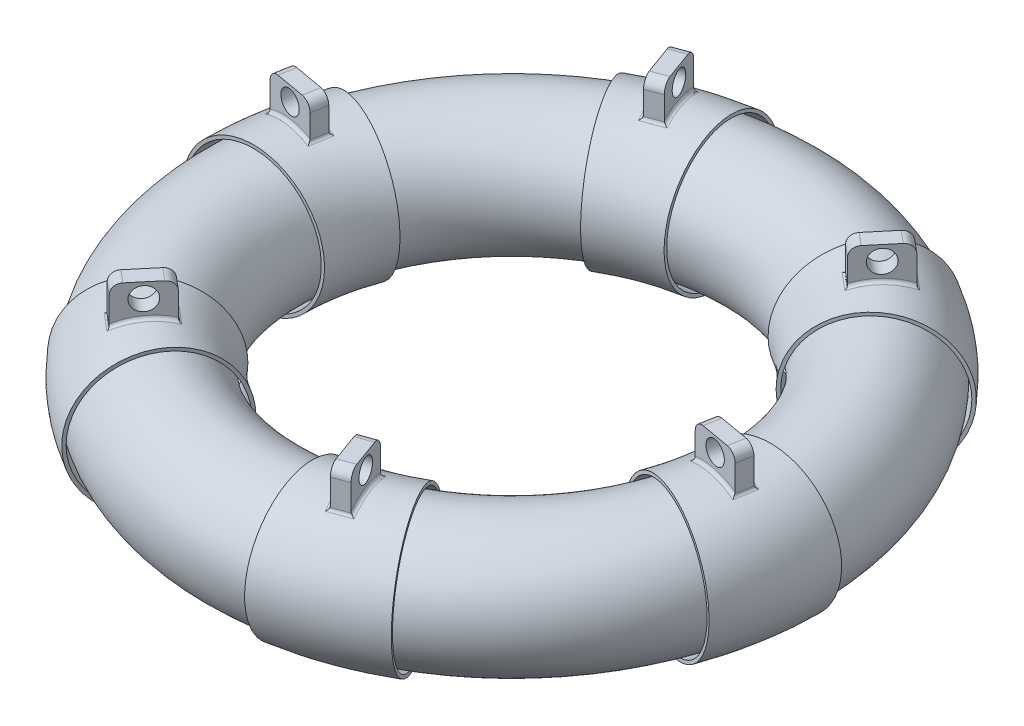
from build123d import *

# Parameters (mm, degrees)
SKETCH1_R                                  = 20
SKETCH2_R                                  = 22
SKETCH2_R_2                                = 21
REVOLVE_THIN1_ANGLE                        = 20
BOSS_EXTRUDE1_START                        = 22
BOSS_EXTRUDE1_DEPTH                        = 10
BOSS_EXTRUDE1_DIRECTION_2_REACH            = 168.527
BOSS_EXTRUDE1_DIRECTION_2_END_MAJOR_RADIUS = 80
BOSS_EXTRUDE1_DIRECTION_2_END_MINOR_RADIUS = 22
FILLET3_R                                  = 1
FILLET4_R                                  = 3
SKETCH5_R                                  = 3.5
CUT_EXTRUDE2_DEPTH                         = 10
CIRPATTERN3_COUNT                          = 6


with BuildPart() as part:
    # Sketch1 → Revolve1 (revolve)
    with BuildSketch(Plane.XY, mode=Mode.PRIVATE) as revolve1_sk:
        with Locations((-80, 0)):
            Circle(SKETCH1_R)
    revolve(revolve1_sk.sketch.rotate(Axis((0, 14.215537248, 0), (0, -1, 0)), 270), axis=Axis((0, 14.215537248, 0), (0, -1, 0)))


with BuildPart() as body_2:
    # Sketch2 → Revolve-Thin1 (revolve)
    with BuildSketch(Plane.XY):
        with Locations((-80, 0)):
            Circle(SKETCH2_R)
        with Locations((-80, 0)):
            Circle(SKETCH2_R_2, mode=Mode.SUBTRACT)
    revolve(axis=Axis((0, 0, 0), (0, -1, 0)), revolution_arc=REVOLVE_THIN1_ANGLE)

    # Sketch3 → Boss-Extrude1 (add)
    with BuildSketch(Plane(origin=(0, 0, 0), x_dir=(1, 0, 0), z_dir=(0, 1, 0)).offset(BOSS_EXTRUDE1_START)):
        Polygon((-86.914637332, 17.86396211), (-71.914637332, 15.219057399), (-72.78287822, 10.295018634), (-87.78287822, 12.939923345), align=None)
    extrude(amount=BOSS_EXTRUDE1_DEPTH)

    # Boss-Extrude1 direction 2: up to this torus (the profile starts outside it)
    boss_extrude1_direction_2_end = Plane(origin=(0, 0, 0), z_dir=(0, 1, 0)) * Torus(BOSS_EXTRUDE1_DIRECTION_2_END_MAJOR_RADIUS, BOSS_EXTRUDE1_DIRECTION_2_END_MINOR_RADIUS, mode=Mode.PRIVATE)
    # Sketch3 → Boss-Extrude1 direction 2 (add, up to the surface)
    with BuildSketch(Plane(origin=(0, 0, 0), x_dir=(1, 0, 0), z_dir=(0, 1, 0)).offset(BOSS_EXTRUDE1_START), mode=Mode.PRIVATE) as boss_extrude1_direction_2_sk1:
        Polygon((-86.914637332, 17.86396211), (-71.914637332, 15.219057399), (-72.78287822, 10.295018634), (-87.78287822, 12.939923345), align=None)
    boss_extrude1_direction_2_tool1 = extrude(boss_extrude1_direction_2_sk1.sketch, amount=-BOSS_EXTRUDE1_DIRECTION_2_REACH, mode=Mode.PRIVATE) - boss_extrude1_direction_2_end
    add(boss_extrude1_direction_2_tool1.solids().sort_by_distance((-79.848758, 22, -14.07949))[0])
    add(boss_extrude1_direction_2_tool1.solids().sort_by_distance((-79.848758, 22, -14.07949))[1])

    # Fillet3
    fillet3_edges = [body_2.edges().sort_by_distance(p)[0] for p in [
        (-79.487427081, 21.967631588, -16.554344551),
        (-72.348757776, 21.006948071, -12.757038017),
        (-80.35566797, 21.967631588, -11.630305786),
        (-87.348757776, 20.208294852, -15.401942727),
    ]]
    fillet(fillet3_edges, radius=FILLET3_R)

    # Fillet4
    fillet4_edges = [body_2.edges().sort_by_distance(p)[0] for p in [
        (-87.348757776, 32, -15.401942727),
        (-72.348757776, 32, -12.757038017),
    ]]
    fillet(fillet4_edges, radius=FILLET4_R)

    # Sketch5 → Cut-Extrude2 (cut)
    with BuildSketch(Plane(origin=(-0.434120444, 0, 2.462019383), x_dir=(0.9848077530122079, 0, 0.17364817766693155), z_dir=(-0.17364817766693155, 0, 0.9848077530122079))):
        with Locations((-81.080553572, 27.485463455)):
            Circle(SKETCH5_R)
    extrude(amount=-CUT_EXTRUDE2_DEPTH, mode=Mode.SUBTRACT)


with BuildPart() as cirpattern3_1:
    # CirPattern3: pattern copy
    add(body_2.part.rotate(Axis((0, 0, 0), (0, 1, 0)), 1 * 360 / CIRPATTERN3_COUNT))


with BuildPart() as cirpattern3_2:
    # CirPattern3: pattern copy
    add(body_2.part.rotate(Axis((0, 0, 0), (0, 1, 0)), 2 * 360 / CIRPATTERN3_COUNT))


with BuildPart() as cirpattern3_3:
    # CirPattern3: pattern copy
    add(body_2.part.rotate(Axis((0, 0, 0), (0, 1, 0)), 3 * 360 / CIRPATTERN3_COUNT))


with BuildPart() as cirpattern3_4:
    # CirPattern3: pattern copy
    add(body_2.part.rotate(Axis((0, 0, 0), (0, 1, 0)), 4 * 360 / CIRPATTERN3_COUNT))


with BuildPart() as cirpattern3_5:
    # CirPattern3: pattern copy
    add(body_2.part.rotate(Axis((0, 0, 0), (0, 1, 0)), 5 * 360 / CIRPATTERN3_COUNT))


solid = Compound([part.part, body_2.part, cirpattern3_1.part, cirpattern3_2.part, cirpattern3_3.part, cirpattern3_4.part, cirpattern3_5.part])
